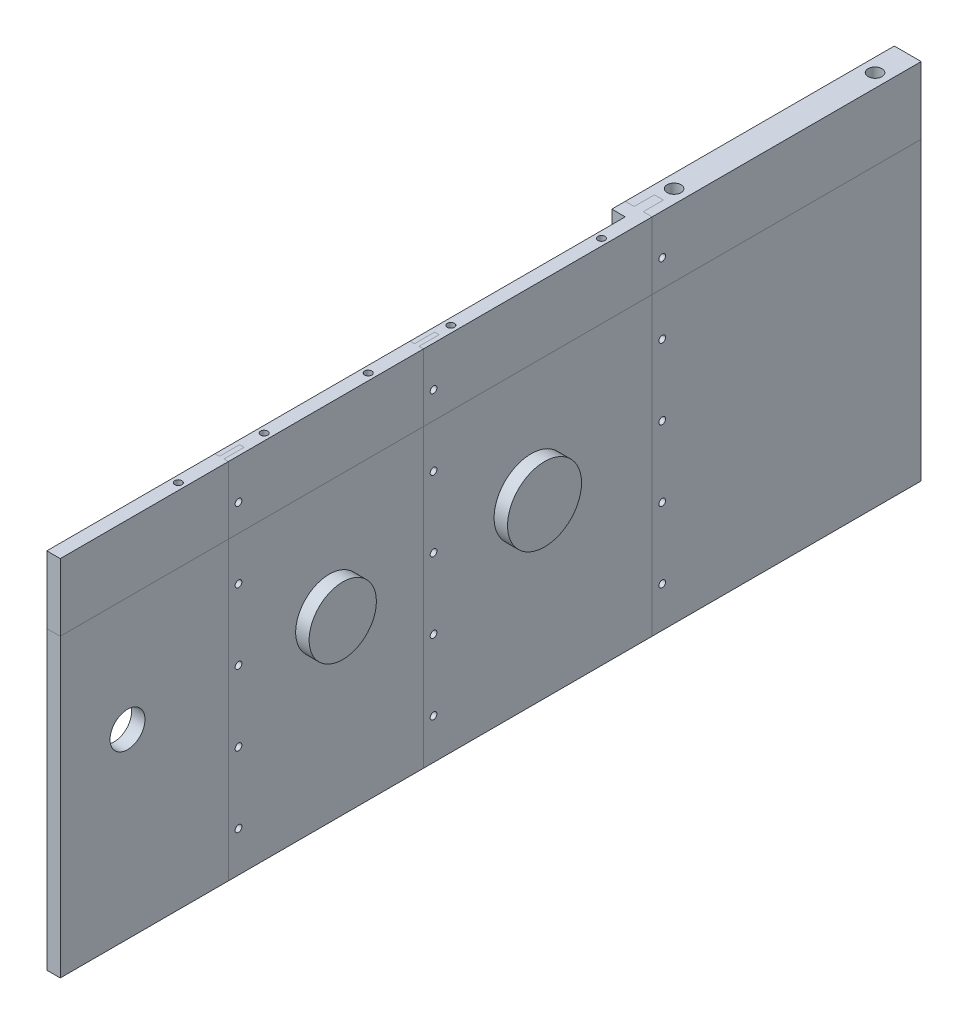
from build123d import *

# Parameters (mm, degrees)
SKETCH1_W               = 640
SKETCH1_H               = 270
SKETCH1_R               = 13
SKETCH1_R_2             = 14
SKETCH1_R_3             = 20.15
BOSS_EXTRUDE1_DEPTH     = 10
SKETCH2_W               = 200
SKETCH2_H               = 270
SKETCH2_R               = 7.94
BOSS_EXTRUDE2_DEPTH     = 20
SKETCH3_W               = 190
SKETCH3_H               = 270
CUT_EXTRUDE1_DEPTH      = 10
SKETCH4_W               = 10
SKETCH4_H               = 270
BOSS_EXTRUDE3_DEPTH     = 10
SKETCH5_W               = 10
SKETCH5_H               = 270
CUT_EXTRUDE2_DEPTH      = 10
CUT_EXTRUDE3_DEPTH      = 348.455033062
CUT_EXTRUDE3_DEPTH_BACK = 348.455033062
SKETCH8_R               = 20.15
SKETCH12_W              = 200
SKETCH12_H              = 270
BOSS_EXTRUDE4_DEPTH     = 10
CUT_EXTRUDE4_DEPTH      = 348.886475736
CUT_EXTRUDE4_DEPTH_BACK = 348.886475736
SKETCH14_R              = 2.5
SPLIT1_OUTLINE_W        = 270
SPLIT1_OUTLINE_H        = 155
SPLIT1_OUTLINE_R        = 14
SPLIT1_DEPTH            = 10
SPLIT1_START            = -3.34
SPLIT1_2_OUTLINE_W      = 270
SPLIT1_2_OUTLINE_H      = 25
SPLIT1_2_OUTLINE_R      = 2.5
SPLIT1_2_DEPTH          = 6.68
SPLIT1_START_2          = -10
SPLIT1_3_OUTLINE_W      = 270
SPLIT1_3_OUTLINE_H      = 10
SPLIT1_3_DEPTH          = 6.66
SPLIT1_4_OUTLINE_W      = 270
SPLIT1_4_OUTLINE_H      = 15
SPLIT1_4_OUTLINE_R      = 2.5
SPLIT1_4_DEPTH          = 3.33
SPLIT1_START_3          = 6.67
SPLIT1_5_OUTLINE_W      = 270
SPLIT1_5_OUTLINE_H      = 15
SPLIT1_5_OUTLINE_R      = 2.5
SPLIT1_5_DEPTH          = 3.33
SPLIT1_6_OUTLINE_W      = 270
SPLIT1_6_OUTLINE_H      = 130
SPLIT1_6_OUTLINE_R      = 13
SPLIT1_6_DEPTH          = 10
SPLIT1_START_4          = 3.33
SPLIT1_7_OUTLINE_W      = 270
SPLIT1_7_OUTLINE_H      = 15
SPLIT1_7_OUTLINE_R      = 2.5
SPLIT1_7_DEPTH          = 3.34
SPLIT1_8_OUTLINE_W      = 270
SPLIT1_8_OUTLINE_H      = 15
SPLIT1_8_OUTLINE_R      = 2.5
SPLIT1_8_DEPTH          = 3.33
SPLIT1_9_OUTLINE_W      = 270
SPLIT1_9_OUTLINE_H      = 15
SPLIT1_9_OUTLINE_R      = 2.5
SPLIT1_9_DEPTH          = 3.33
SPLIT1_10_OUTLINE_W     = 270
SPLIT1_10_OUTLINE_H     = 125
SPLIT1_10_OUTLINE_R     = 13
SPLIT1_10_DEPTH         = 10
SPLIT1_11_OUTLINE_W     = 270
SPLIT1_11_OUTLINE_H     = 15
SPLIT1_11_OUTLINE_R     = 2.5
SPLIT1_11_DEPTH         = 3.34
SPLIT1_START_5          = -11
SPLIT1_12_OUTLINE_W     = 270
SPLIT1_12_OUTLINE_H     = 440
SPLIT1_12_OUTLINE_R     = 13
SPLIT1_12_OUTLINE_R_2   = 2.5
SPLIT1_12_OUTLINE_R_3   = 14
SPLIT1_12_DEPTH         = 21
SPLIT1_13_OUTLINE_W     = 270
SPLIT1_13_OUTLINE_H     = 15
SPLIT1_13_OUTLINE_R     = 2.5
SPLIT1_13_DEPTH         = 6.68
SKETCH15_R              = 5.15
SKETCH15_R_2            = 2.65
CUT_EXTRUDE5_DEPTH      = 100
SPLIT2_OUTLINE_W        = 50
SPLIT2_OUTLINE_H        = 185
SPLIT2_OUTLINE_R        = 2.5
SPLIT2_DEPTH            = 2.3499999
SPLIT2_START            = 7.6500001
SPLIT2_2_OUTLINE_W      = 50
SPLIT2_2_OUTLINE_H      = 170
SPLIT2_2_OUTLINE_R      = 2.5
SPLIT2_2_DEPTH          = 2.3499999
SPLIT2_START_2          = -10
SPLIT2_3_OUTLINE_W      = 50
SPLIT2_3_OUTLINE_H      = 10
SPLIT2_3_DEPTH          = 20
SPLIT2_START_3          = -3.34
SPLIT2_4_OUTLINE_W      = 50
SPLIT2_4_OUTLINE_H      = 15
SPLIT2_4_OUTLINE_R      = 2.5
SPLIT2_4_DEPTH          = 6.68
SPLIT2_5_OUTLINE_W      = 50
SPLIT2_5_OUTLINE_H      = 15
SPLIT2_5_OUTLINE_R      = 2.5
SPLIT2_5_DEPTH          = 3.33
SPLIT2_START_4          = 6.67
SPLIT2_6_OUTLINE_W      = 50
SPLIT2_6_OUTLINE_H      = 15
SPLIT2_6_OUTLINE_R      = 2.5
SPLIT2_6_DEPTH          = 3.33
SPLIT2_START_5          = 85
SPLIT2_7_DEPTH          = 50
SPLIT2_8_OUTLINE_W      = 50
SPLIT2_8_OUTLINE_H      = 125
SPLIT2_8_DEPTH          = 2.3499999
SPLIT2_9_OUTLINE_W      = 50
SPLIT2_9_OUTLINE_H      = 125
SPLIT2_9_DEPTH          = 2.3499999
SPLIT2_START_6          = 3.33
SPLIT2_10_OUTLINE_W     = 50
SPLIT2_10_OUTLINE_H     = 15
SPLIT2_10_OUTLINE_R     = 2.5
SPLIT2_10_DEPTH         = 3.34
SPLIT2_11_DEPTH         = 50
SPLIT2_12_OUTLINE_R     = 2.65
SPLIT2_12_DEPTH         = 50
SPLIT2_13_OUTLINE_R     = 2.65
SPLIT2_13_DEPTH         = 50
SPLIT2_14_OUTLINE_R     = 5.15
SPLIT2_14_DEPTH         = 50
SPLIT2_15_OUTLINE_W     = 50
SPLIT2_15_OUTLINE_H     = 145
SPLIT2_15_OUTLINE_R     = 2.5
SPLIT2_15_DEPTH         = 2.3499999
SPLIT2_16_OUTLINE_W     = 50
SPLIT2_16_OUTLINE_H     = 145
SPLIT2_16_OUTLINE_R     = 2.5
SPLIT2_16_DEPTH         = 2.3499999
SPLIT2_17_OUTLINE_W     = 50
SPLIT2_17_OUTLINE_H     = 15
SPLIT2_17_OUTLINE_R     = 2.5
SPLIT2_17_DEPTH         = 3.34
SPLIT2_18_OUTLINE_W     = 50
SPLIT2_18_OUTLINE_H     = 15
SPLIT2_18_OUTLINE_R     = 2.5
SPLIT2_18_DEPTH         = 3.33
SPLIT2_19_OUTLINE_W     = 50
SPLIT2_19_OUTLINE_H     = 15
SPLIT2_19_OUTLINE_R     = 2.5
SPLIT2_19_DEPTH         = 3.33
SPLIT2_20_DEPTH         = 50
SPLIT2_21_OUTLINE_R     = 2.65
SPLIT2_21_DEPTH         = 50
SPLIT2_22_OUTLINE_W     = 50
SPLIT2_22_OUTLINE_H     = 200
SPLIT2_22_OUTLINE_R     = 2.5
SPLIT2_22_DEPTH         = 4.8499999
SPLIT2_START_7          = 5.1500001
SPLIT2_23_OUTLINE_W     = 50
SPLIT2_23_OUTLINE_H     = 200
SPLIT2_23_OUTLINE_R     = 2.5
SPLIT2_23_DEPTH         = 4.8499999
SPLIT2_24_OUTLINE_W     = 50
SPLIT2_24_OUTLINE_H     = 15
SPLIT2_24_OUTLINE_R     = 2.5
SPLIT2_24_DEPTH         = 6.66
SPLIT2_START_8          = 3.34
SPLIT2_25_OUTLINE_W     = 50
SPLIT2_25_OUTLINE_H     = 15
SPLIT2_25_OUTLINE_R     = 2.5
SPLIT2_25_DEPTH         = 6.66
SPLIT2_26_DEPTH         = 50
SKETCH17_R              = 25
BOSS_EXTRUDE5_DEPTH     = 10
SKETCH18_R              = 27.5
BOSS_EXTRUDE6_DEPTH     = 10


with BuildPart() as part:
    # Sketch1 → Boss-Extrude1 (new body)
    with BuildSketch(Plane(origin=(0, 0, 0), x_dir=(0, 0, -1), z_dir=(1, 0, 0))):
        Rectangle(SKETCH1_W, SKETCH1_H)
        with Locations((-270, 0)):
            Circle(SKETCH1_R, mode=Mode.SUBTRACT)
        with Locations((-120, 0)):
            Circle(SKETCH1_R, mode=Mode.SUBTRACT)
        with Locations((30, 0)):
            Circle(SKETCH1_R_2, mode=Mode.SUBTRACT)
        with Locations((180, 0)):
            Circle(SKETCH1_R_3, mode=Mode.SUBTRACT)
    extrude(amount=BOSS_EXTRUDE1_DEPTH)

    # Sketch2 → Boss-Extrude2 (add)
    with BuildSketch(Plane(origin=(10, 0, 0), x_dir=(0, 0, -1), z_dir=(1, 0, 0))):
        with Locations((220, 0)):
            Rectangle(SKETCH2_W, SKETCH2_H)
        with Locations((180, 0)):
            Circle(SKETCH2_R, mode=Mode.SUBTRACT)
    extrude(amount=-BOSS_EXTRUDE2_DEPTH)

    # Sketch3 → Cut-Extrude1 (cut)
    with BuildSketch(Plane(origin=(10, 0, 0), x_dir=(0, 0, -1), z_dir=(1, 0, 0))):
        with Locations((225, 0)):
            Rectangle(SKETCH3_W, SKETCH3_H)
    extrude(amount=-CUT_EXTRUDE1_DEPTH, mode=Mode.SUBTRACT)

    # Sketch4 → Boss-Extrude3 (add)
    with BuildSketch(Plane.ZY):
        with Locations((-115, 0)):
            Rectangle(SKETCH4_W, SKETCH4_H)
    extrude(amount=BOSS_EXTRUDE3_DEPTH)

    # Sketch5 → Cut-Extrude2 (cut)
    with BuildSketch(Plane(origin=(10, 0, 0), x_dir=(0, 0, -1), z_dir=(1, 0, 0))):
        with Locations((125, 0)):
            Rectangle(SKETCH5_W, SKETCH5_H)
    extrude(amount=-CUT_EXTRUDE2_DEPTH, mode=Mode.SUBTRACT)

    # Sketch8 → Cut-Extrude3 (cut, two sides: drawn at the far end of the back side and taken through both)
    with BuildSketch(Plane(origin=(0, 0, 0), x_dir=(0, 0, -1), z_dir=(1, 0, 0)).offset(-CUT_EXTRUDE3_DEPTH_BACK)):
        with Locations((180, 0)):
            Circle(SKETCH8_R)
    extrude(amount=CUT_EXTRUDE3_DEPTH + CUT_EXTRUDE3_DEPTH_BACK, mode=Mode.SUBTRACT)

    # Sketch12 → Boss-Extrude4 (add)
    with BuildSketch(Plane(origin=(0, 0, 0), x_dir=(0, 0, -1), z_dir=(1, 0, 0))):
        with Locations((220, 0)):
            Rectangle(SKETCH12_W, SKETCH12_H)
    extrude(amount=BOSS_EXTRUDE4_DEPTH)

    # Sketch14 → Cut-Extrude4 (cut, two sides: drawn at the far end of the back side and taken through both)
    with BuildSketch(Plane(origin=(10, 0, 0), x_dir=(0, 0, -1), z_dir=(1, 0, 0)).offset(-CUT_EXTRUDE4_DEPTH_BACK)):
        with Locations((-42.5, 105)):
            Circle(SKETCH14_R)
        with Locations((-42.5, 52.5)):
            Circle(SKETCH14_R)
        with Locations((-42.5, 0)):
            Circle(SKETCH14_R)
        with Locations((-42.5, -52.5)):
            Circle(SKETCH14_R)
        with Locations((-42.5, -105)):
            Circle(SKETCH14_R)
        with Locations(Location((127.5, -105, 0), (0, 0, 180))):
            Circle(SKETCH14_R)
        with Locations(Location((127.5, -52.5, 0), (0, 0, 180))):
            Circle(SKETCH14_R)
        with Locations(Location((127.5, 0, 0), (0, 0, 180))):
            Circle(SKETCH14_R)
        with Locations(Location((127.5, 52.5, 0), (0, 0, 180))):
            Circle(SKETCH14_R)
        with Locations(Location((127.5, 105, 0), (0, 0, 180))):
            Circle(SKETCH14_R)
        with Locations((-187.5, -105)):
            Circle(SKETCH14_R)
        with Locations((-187.5, -52.5)):
            Circle(SKETCH14_R)
        with Locations((-187.5, 0)):
            Circle(SKETCH14_R)
        with Locations((-187.5, 52.5)):
            Circle(SKETCH14_R)
        with Locations((-187.5, 105)):
            Circle(SKETCH14_R)
    extrude(amount=CUT_EXTRUDE4_DEPTH + CUT_EXTRUDE4_DEPTH_BACK, mode=Mode.SUBTRACT)

    # Split1 12 outline → Split1 12 (cut)
    with BuildSketch(Plane.YZ.offset(SPLIT1_START_5)):
        with Locations((0, 100)):
            Rectangle(SPLIT1_12_OUTLINE_W, SPLIT1_12_OUTLINE_H)
        with Locations((0, 270)):
            Circle(SPLIT1_12_OUTLINE_R, mode=Mode.SUBTRACT)
        with Locations((-105, 42.5)):
            Circle(SPLIT1_12_OUTLINE_R_2, mode=Mode.SUBTRACT)
        with Locations((-52.5, 42.5)):
            Circle(SPLIT1_12_OUTLINE_R_2, mode=Mode.SUBTRACT)
        with Locations((0, -30)):
            Circle(SPLIT1_12_OUTLINE_R_3, mode=Mode.SUBTRACT)
        with Locations((0, 42.5)):
            Circle(SPLIT1_12_OUTLINE_R_2, mode=Mode.SUBTRACT)
        with Locations((52.5, 42.5)):
            Circle(SPLIT1_12_OUTLINE_R_2, mode=Mode.SUBTRACT)
        with Locations((105, 42.5)):
            Circle(SPLIT1_12_OUTLINE_R_2, mode=Mode.SUBTRACT)
        with Locations((-105, 187.5)):
            Circle(SPLIT1_12_OUTLINE_R_2, mode=Mode.SUBTRACT)
        with Locations((-52.5, 187.5)):
            Circle(SPLIT1_12_OUTLINE_R_2, mode=Mode.SUBTRACT)
        with Locations((0, 120)):
            Circle(SPLIT1_12_OUTLINE_R, mode=Mode.SUBTRACT)
        with Locations((0, 187.5)):
            Circle(SPLIT1_12_OUTLINE_R_2, mode=Mode.SUBTRACT)
        with Locations((52.5, 187.5)):
            Circle(SPLIT1_12_OUTLINE_R_2, mode=Mode.SUBTRACT)
        with Locations((105, 187.5)):
            Circle(SPLIT1_12_OUTLINE_R_2, mode=Mode.SUBTRACT)
    extrude(amount=SPLIT1_12_DEPTH, mode=Mode.SUBTRACT)

    # Split1 13 outline → Split1 13 (cut)
    with BuildSketch(Plane.YZ.offset(SPLIT1_START)):
        with Locations((0, -127.5)):
            Rectangle(SPLIT1_13_OUTLINE_W, SPLIT1_13_OUTLINE_H)
        with Locations((-105, -127.5)):
            Circle(SPLIT1_13_OUTLINE_R, mode=Mode.SUBTRACT)
        with Locations((-52.5, -127.5)):
            Circle(SPLIT1_13_OUTLINE_R, mode=Mode.SUBTRACT)
        with Locations((0, -127.5)):
            Circle(SPLIT1_13_OUTLINE_R, mode=Mode.SUBTRACT)
        with Locations((52.5, -127.5)):
            Circle(SPLIT1_13_OUTLINE_R, mode=Mode.SUBTRACT)
        with Locations((105, -127.5)):
            Circle(SPLIT1_13_OUTLINE_R, mode=Mode.SUBTRACT)
    extrude(amount=SPLIT1_13_DEPTH, mode=Mode.SUBTRACT)


with BuildPart() as body_2:
    # Split1: read off the stored shape, not the designer's step
    # Split1 outline → Split1 (new body)
    with BuildSketch(Plane.YZ):
        with Locations((0, -42.5)):
            Rectangle(SPLIT1_OUTLINE_W, SPLIT1_OUTLINE_H)
        with Locations((0, -30)):
            Circle(SPLIT1_OUTLINE_R, mode=Mode.SUBTRACT)
    extrude(amount=SPLIT1_DEPTH)

    # Split1 2 outline → Split1 2 (add)
    with BuildSketch(Plane.YZ.offset(SPLIT1_START)):
        with Locations((0, -122.5)):
            Rectangle(SPLIT1_2_OUTLINE_W, SPLIT1_2_OUTLINE_H)
        with Locations((-105, -127.5)):
            Circle(SPLIT1_2_OUTLINE_R, mode=Mode.SUBTRACT)
        with Locations((-52.5, -127.5)):
            Circle(SPLIT1_2_OUTLINE_R, mode=Mode.SUBTRACT)
        with Locations((0, -127.5)):
            Circle(SPLIT1_2_OUTLINE_R, mode=Mode.SUBTRACT)
        with Locations((52.5, -127.5)):
            Circle(SPLIT1_2_OUTLINE_R, mode=Mode.SUBTRACT)
        with Locations((105, -127.5)):
            Circle(SPLIT1_2_OUTLINE_R, mode=Mode.SUBTRACT)
    extrude(amount=SPLIT1_2_DEPTH)

    # Split1 3 outline → Split1 3 (add)
    with BuildSketch(Plane.YZ.offset(SPLIT1_START_2)):
        with Locations((0, -115)):
            Rectangle(SPLIT1_3_OUTLINE_W, SPLIT1_3_OUTLINE_H)
    extrude(amount=SPLIT1_3_DEPTH)

    # Split1 4 outline → Split1 4 (add)
    with BuildSketch(Plane.YZ):
        with Locations((0, 42.5)):
            Rectangle(SPLIT1_4_OUTLINE_W, SPLIT1_4_OUTLINE_H)
        with Locations((-105, 42.5)):
            Circle(SPLIT1_4_OUTLINE_R, mode=Mode.SUBTRACT)
        with Locations((-52.5, 42.5)):
            Circle(SPLIT1_4_OUTLINE_R, mode=Mode.SUBTRACT)
        with Locations((0, 42.5)):
            Circle(SPLIT1_4_OUTLINE_R, mode=Mode.SUBTRACT)
        with Locations((52.5, 42.5)):
            Circle(SPLIT1_4_OUTLINE_R, mode=Mode.SUBTRACT)
        with Locations((105, 42.5)):
            Circle(SPLIT1_4_OUTLINE_R, mode=Mode.SUBTRACT)
    extrude(amount=SPLIT1_4_DEPTH)

    # Split1 5 outline → Split1 5 (add)
    with BuildSketch(Plane.YZ.offset(SPLIT1_START_3)):
        with Locations((0, 42.5)):
            Rectangle(SPLIT1_5_OUTLINE_W, SPLIT1_5_OUTLINE_H)
        with Locations((-105, 42.5)):
            Circle(SPLIT1_5_OUTLINE_R, mode=Mode.SUBTRACT)
        with Locations((-52.5, 42.5)):
            Circle(SPLIT1_5_OUTLINE_R, mode=Mode.SUBTRACT)
        with Locations((0, 42.5)):
            Circle(SPLIT1_5_OUTLINE_R, mode=Mode.SUBTRACT)
        with Locations((52.5, 42.5)):
            Circle(SPLIT1_5_OUTLINE_R, mode=Mode.SUBTRACT)
        with Locations((105, 42.5)):
            Circle(SPLIT1_5_OUTLINE_R, mode=Mode.SUBTRACT)
    extrude(amount=SPLIT1_5_DEPTH)


with BuildPart() as body_3:
    # Split1 6 outline → Split1 6 (new body)
    with BuildSketch(Plane.YZ):
        with Locations((0, 115)):
            Rectangle(SPLIT1_6_OUTLINE_W, SPLIT1_6_OUTLINE_H)
        with Locations((0, 120)):
            Circle(SPLIT1_6_OUTLINE_R, mode=Mode.SUBTRACT)
    extrude(amount=SPLIT1_6_DEPTH)

    # Split1 7 outline → Split1 7 (add)
    with BuildSketch(Plane.YZ.offset(SPLIT1_START_4)):
        with Locations((0, 42.5)):
            Rectangle(SPLIT1_7_OUTLINE_W, SPLIT1_7_OUTLINE_H)
        with Locations((-105, 42.5)):
            Circle(SPLIT1_7_OUTLINE_R, mode=Mode.SUBTRACT)
        with Locations((-52.5, 42.5)):
            Circle(SPLIT1_7_OUTLINE_R, mode=Mode.SUBTRACT)
        with Locations((0, 42.5)):
            Circle(SPLIT1_7_OUTLINE_R, mode=Mode.SUBTRACT)
        with Locations((52.5, 42.5)):
            Circle(SPLIT1_7_OUTLINE_R, mode=Mode.SUBTRACT)
        with Locations((105, 42.5)):
            Circle(SPLIT1_7_OUTLINE_R, mode=Mode.SUBTRACT)
    extrude(amount=SPLIT1_7_DEPTH)

    # Split1 8 outline → Split1 8 (add)
    with BuildSketch(Plane.YZ):
        with Locations((0, 187.5)):
            Rectangle(SPLIT1_8_OUTLINE_W, SPLIT1_8_OUTLINE_H)
        with Locations((-105, 187.5)):
            Circle(SPLIT1_8_OUTLINE_R, mode=Mode.SUBTRACT)
        with Locations((-52.5, 187.5)):
            Circle(SPLIT1_8_OUTLINE_R, mode=Mode.SUBTRACT)
        with Locations((0, 187.5)):
            Circle(SPLIT1_8_OUTLINE_R, mode=Mode.SUBTRACT)
        with Locations((52.5, 187.5)):
            Circle(SPLIT1_8_OUTLINE_R, mode=Mode.SUBTRACT)
        with Locations((105, 187.5)):
            Circle(SPLIT1_8_OUTLINE_R, mode=Mode.SUBTRACT)
    extrude(amount=SPLIT1_8_DEPTH)

    # Split1 9 outline → Split1 9 (add)
    with BuildSketch(Plane.YZ.offset(SPLIT1_START_3)):
        with Locations((0, 187.5)):
            Rectangle(SPLIT1_9_OUTLINE_W, SPLIT1_9_OUTLINE_H)
        with Locations((-105, 187.5)):
            Circle(SPLIT1_9_OUTLINE_R, mode=Mode.SUBTRACT)
        with Locations((-52.5, 187.5)):
            Circle(SPLIT1_9_OUTLINE_R, mode=Mode.SUBTRACT)
        with Locations((0, 187.5)):
            Circle(SPLIT1_9_OUTLINE_R, mode=Mode.SUBTRACT)
        with Locations((52.5, 187.5)):
            Circle(SPLIT1_9_OUTLINE_R, mode=Mode.SUBTRACT)
        with Locations((105, 187.5)):
            Circle(SPLIT1_9_OUTLINE_R, mode=Mode.SUBTRACT)
    extrude(amount=SPLIT1_9_DEPTH)


with BuildPart() as body_4:
    # Split1 10 outline → Split1 10 (new body)
    with BuildSketch(Plane.YZ):
        with Locations((0, 257.5)):
            Rectangle(SPLIT1_10_OUTLINE_W, SPLIT1_10_OUTLINE_H)
        with Locations((0, 270)):
            Circle(SPLIT1_10_OUTLINE_R, mode=Mode.SUBTRACT)
    extrude(amount=SPLIT1_10_DEPTH)

    # Split1 11 outline → Split1 11 (add)
    with BuildSketch(Plane.YZ.offset(SPLIT1_START_4)):
        with Locations((0, 187.5)):
            Rectangle(SPLIT1_11_OUTLINE_W, SPLIT1_11_OUTLINE_H)
        with Locations((-105, 187.5)):
            Circle(SPLIT1_11_OUTLINE_R, mode=Mode.SUBTRACT)
        with Locations((-52.5, 187.5)):
            Circle(SPLIT1_11_OUTLINE_R, mode=Mode.SUBTRACT)
        with Locations((0, 187.5)):
            Circle(SPLIT1_11_OUTLINE_R, mode=Mode.SUBTRACT)
        with Locations((52.5, 187.5)):
            Circle(SPLIT1_11_OUTLINE_R, mode=Mode.SUBTRACT)
        with Locations((105, 187.5)):
            Circle(SPLIT1_11_OUTLINE_R, mode=Mode.SUBTRACT)
    extrude(amount=SPLIT1_11_DEPTH)


with BuildPart() as cut_extrude5_tool:
    # Sketch15 → Cut-Extrude5 (new body)
    with BuildSketch(Plane(origin=(0, 135, 0), x_dir=(1, 0, 0), z_dir=(0, 1, 0))):
        with Locations(Location((0, 295.673954542, 0), (0, 0, 270))):
            Circle(SKETCH15_R)
        with Locations(Location((0, 146.286931387, 0), (0, 0, 270))):
            Circle(SKETCH15_R)
        with Locations(Location((5, 87.264370098, 0), (0, 0, 270))):
            Circle(SKETCH15_R_2)
        with Locations(Location((5, -24.653825531, 0), (0, 0, 270))):
            Circle(SKETCH15_R_2)
        with Locations(Location((5, -86.063192997, 0), (0, 0, 270))):
            Circle(SKETCH15_R_2)
        with Locations(Location((5, -163.412693245, 0), (0, 0, 270))):
            Circle(SKETCH15_R_2)
        with Locations(Location((5, -227.217653234, 0), (0, 0, 270))):
            Circle(SKETCH15_R_2)
    extrude(amount=-CUT_EXTRUDE5_DEPTH)


with BuildPart() as part_1:
    add(part.part)

    # Cut-Extrude5: cut by cut_extrude5_tool
    add(cut_extrude5_tool.part, mode=Mode.SUBTRACT)

    # Split2 14 outline → Split2 14 (cut)
    with BuildSketch(Plane(origin=(0, 0, 0), x_dir=(1, 0, 0), z_dir=(0, 1, 0)).offset(SPLIT2_START_5)):
        Polygon((-3.34, 135), (3.34, 135), (3.34, 120), (10, 120), (10, 320), (-10, 320), (-10, 120), (-3.34, 120), align=None)
        with Locations((0, 146.286931387)):
            Circle(SPLIT2_14_OUTLINE_R, mode=Mode.SUBTRACT)
        with Locations((0, 295.673954542)):
            Circle(SPLIT2_14_OUTLINE_R, mode=Mode.SUBTRACT)
    extrude(amount=SPLIT2_14_DEPTH, mode=Mode.SUBTRACT)


with BuildPart() as body_2_1:
    add(body_2.part)

    # Cut-Extrude5: cut by cut_extrude5_tool
    add(cut_extrude5_tool.part, mode=Mode.SUBTRACT)

    # Split2 21 outline → Split2 21 (cut)
    with BuildSketch(Plane(origin=(0, 0, 0), x_dir=(1, 0, 0), z_dir=(0, 1, 0)).offset(SPLIT2_START_5)):
        Polygon((3.34, 120), (3.34, 135), (-3.34, 135), (-3.34, 120), (-10, 120), (-10, 110), (0, 110), (0, -50), (3.33, -50), (3.33, -35), (6.67, -35), (6.67, -50), (10, -50), (10, 120), align=None)
        with Locations((5, -24.653825531)):
            Circle(SPLIT2_21_OUTLINE_R, mode=Mode.SUBTRACT)
        with Locations((5, 87.264370098)):
            Circle(SPLIT2_21_OUTLINE_R, mode=Mode.SUBTRACT)
    extrude(amount=SPLIT2_21_DEPTH, mode=Mode.SUBTRACT)

    # Sketch18 → Boss-Extrude6 (add)
    with BuildSketch(Plane(origin=(10, 0, 0), x_dir=(0, 0, -1), z_dir=(1, 0, 0))):
        with Locations((30, 0)):
            Circle(SKETCH18_R)
    extrude(amount=BOSS_EXTRUDE6_DEPTH)


with BuildPart() as body_3_1:
    add(body_3.part)

    # Cut-Extrude5: cut by cut_extrude5_tool
    add(cut_extrude5_tool.part, mode=Mode.SUBTRACT)

    # Split2 13 outline → Split2 13 (cut)
    with BuildSketch(Plane(origin=(0, 0, 0), x_dir=(1, 0, 0), z_dir=(0, 1, 0)).offset(SPLIT2_START_5)):
        Polygon((3.33, -35), (3.33, -50), (0, -50), (0, -195), (3.33, -195), (3.33, -180), (6.67, -180), (6.67, -195), (10, -195), (10, -50), (6.67, -50), (6.67, -35), align=None)
        with Locations((5, -163.412693245)):
            Circle(SPLIT2_13_OUTLINE_R, mode=Mode.SUBTRACT)
        with Locations((5, -86.063192997)):
            Circle(SPLIT2_13_OUTLINE_R, mode=Mode.SUBTRACT)
    extrude(amount=SPLIT2_13_DEPTH, mode=Mode.SUBTRACT)

    # Sketch17 → Boss-Extrude5 (add)
    with BuildSketch(Plane(origin=(10, 0, 0), x_dir=(0, 0, -1), z_dir=(1, 0, 0))):
        with Locations((-120, 0)):
            Circle(SKETCH17_R)
    extrude(amount=BOSS_EXTRUDE5_DEPTH)


with BuildPart() as body_4_1:
    add(body_4.part)

    # Cut-Extrude5: cut by cut_extrude5_tool
    add(cut_extrude5_tool.part, mode=Mode.SUBTRACT)

    # Split2 12 outline → Split2 12 (cut)
    with BuildSketch(Plane(origin=(0, 0, 0), x_dir=(1, 0, 0), z_dir=(0, 1, 0)).offset(SPLIT2_START_5)):
        Polygon((10, -195), (6.67, -195), (6.67, -180), (3.33, -180), (3.33, -195), (0, -195), (0, -320), (10, -320), align=None)
        with Locations((5, -227.217653234)):
            Circle(SPLIT2_12_OUTLINE_R, mode=Mode.SUBTRACT)
    extrude(amount=SPLIT2_12_DEPTH, mode=Mode.SUBTRACT)


with BuildPart() as body_5:
    # Split2: read off the stored shape, not the designer's step
    # Split2 outline → Split2 (new body)
    with BuildSketch(Plane.YZ):
        with Locations((110, -42.5)):
            Rectangle(SPLIT2_OUTLINE_W, SPLIT2_OUTLINE_H)
        with Locations((105, 42.5)):
            Circle(SPLIT2_OUTLINE_R, mode=Mode.SUBTRACT)
        with Locations((105, -127.5)):
            Circle(SPLIT2_OUTLINE_R, mode=Mode.SUBTRACT)
    extrude(amount=SPLIT2_DEPTH)

    # Split2 2 outline → Split2 2 (add)
    with BuildSketch(Plane.YZ.offset(SPLIT2_START)):
        with Locations((110, -35)):
            Rectangle(SPLIT2_2_OUTLINE_W, SPLIT2_2_OUTLINE_H)
        with Locations((105, 42.5)):
            Circle(SPLIT2_2_OUTLINE_R, mode=Mode.SUBTRACT)
    extrude(amount=SPLIT2_2_DEPTH)

    # Split2 3 outline → Split2 3 (add)
    with BuildSketch(Plane.YZ.offset(SPLIT2_START_2)):
        with Locations((110, -115)):
            Rectangle(SPLIT2_3_OUTLINE_W, SPLIT2_3_OUTLINE_H)
    extrude(amount=SPLIT2_3_DEPTH)

    # Split2 4 outline → Split2 4 (add)
    with BuildSketch(Plane.YZ.offset(SPLIT2_START_3)):
        with Locations((110, -127.5)):
            Rectangle(SPLIT2_4_OUTLINE_W, SPLIT2_4_OUTLINE_H)
        with Locations((105, -127.5)):
            Circle(SPLIT2_4_OUTLINE_R, mode=Mode.SUBTRACT)
    extrude(amount=SPLIT2_4_DEPTH)

    # Split2 5 outline → Split2 5 (add)
    with BuildSketch(Plane.YZ):
        with Locations((110, 42.5)):
            Rectangle(SPLIT2_5_OUTLINE_W, SPLIT2_5_OUTLINE_H)
        with Locations((105, 42.5)):
            Circle(SPLIT2_5_OUTLINE_R, mode=Mode.SUBTRACT)
    extrude(amount=SPLIT2_5_DEPTH)

    # Split2 6 outline → Split2 6 (add)
    with BuildSketch(Plane.YZ.offset(SPLIT2_START_4)):
        with Locations((110, 42.5)):
            Rectangle(SPLIT2_6_OUTLINE_W, SPLIT2_6_OUTLINE_H)
        with Locations((105, 42.5)):
            Circle(SPLIT2_6_OUTLINE_R, mode=Mode.SUBTRACT)
    extrude(amount=SPLIT2_6_DEPTH)

    # Split2 7 outline → Split2 7 (add)
    with BuildSketch(Plane(origin=(0, 0, 0), x_dir=(1, 0, 0), z_dir=(0, 1, 0)).offset(SPLIT2_START_5)):
        with BuildLine():
            Line((7.6500001, -35), (7.65, -24.653825531))
            ThreePointArc((7.65, -24.653825531), (5, -27.303825531), (2.35, -24.653825531))
            Line((2.35, -24.653825531), (2.3499999, -35))
            Line((2.3499999, -35), (7.6500001, -35))
        make_face()
        with BuildLine():
            ThreePointArc((2.35, -24.653825531), (5, -22.003825531), (7.65, -24.653825531))
            Line((7.65, -24.653825531), (7.65, 87.264370098))
            ThreePointArc((7.65, 87.264370098), (5, 84.614370098), (2.35, 87.264370098))
            Line((2.35, 87.264370098), (2.35, -24.653825531))
        make_face()
        with BuildLine():
            ThreePointArc((2.35, 87.264370098), (5, 89.914370098), (7.65, 87.264370098))
            Line((7.65, 87.264370098), (7.6500001, 110))
            Line((7.6500001, 110), (2.3499999, 110))
            Line((2.3499999, 110), (2.35, 87.264370098))
        make_face()
    extrude(amount=SPLIT2_7_DEPTH)


with BuildPart() as body_6:
    # Split2 8 outline → Split2 8 (new body)
    with BuildSketch(Plane.YZ):
        with Locations((110, 257.5)):
            Rectangle(SPLIT2_8_OUTLINE_W, SPLIT2_8_OUTLINE_H)
    extrude(amount=SPLIT2_8_DEPTH)

    # Split2 9 outline → Split2 9 (add)
    with BuildSketch(Plane.YZ.offset(SPLIT2_START)):
        with Locations((110, 257.5)):
            Rectangle(SPLIT2_9_OUTLINE_W, SPLIT2_9_OUTLINE_H)
    extrude(amount=SPLIT2_9_DEPTH)

    # Split2 10 outline → Split2 10 (add)
    with BuildSketch(Plane.YZ.offset(SPLIT2_START_6)):
        with Locations((110, 187.5)):
            Rectangle(SPLIT2_10_OUTLINE_W, SPLIT2_10_OUTLINE_H)
        with Locations((105, 187.5)):
            Circle(SPLIT2_10_OUTLINE_R, mode=Mode.SUBTRACT)
    extrude(amount=SPLIT2_10_DEPTH)

    # Split2 11 outline → Split2 11 (add)
    with BuildSketch(Plane(origin=(0, 0, 0), x_dir=(1, 0, 0), z_dir=(0, 1, 0)).offset(SPLIT2_START_5)):
        with BuildLine():
            Line((7.6500001, -195), (2.3499999, -195))
            Line((2.3499999, -195), (2.35, -227.217653234))
            ThreePointArc((2.35, -227.217653234), (5, -224.567653234), (7.65, -227.217653234))
            Line((7.65, -227.217653234), (7.6500001, -195))
        make_face()
        with BuildLine():
            ThreePointArc((7.65, -227.217653234), (5, -229.867653234), (2.35, -227.217653234))
            Line((2.35, -227.217653234), (2.3499999, -320))
            Line((2.3499999, -320), (7.6500001, -320))
            Line((7.6500001, -320), (7.65, -227.217653234))
        make_face()
    extrude(amount=SPLIT2_11_DEPTH)


with BuildPart() as body_7:
    # Split2 15 outline → Split2 15 (new body)
    with BuildSketch(Plane.YZ):
        with Locations((110, 122.5)):
            Rectangle(SPLIT2_15_OUTLINE_W, SPLIT2_15_OUTLINE_H)
        with Locations((105, 187.5)):
            Circle(SPLIT2_15_OUTLINE_R, mode=Mode.SUBTRACT)
    extrude(amount=SPLIT2_15_DEPTH)

    # Split2 16 outline → Split2 16 (add)
    with BuildSketch(Plane.YZ.offset(SPLIT2_START)):
        with Locations((110, 122.5)):
            Rectangle(SPLIT2_16_OUTLINE_W, SPLIT2_16_OUTLINE_H)
        with Locations((105, 187.5)):
            Circle(SPLIT2_16_OUTLINE_R, mode=Mode.SUBTRACT)
    extrude(amount=SPLIT2_16_DEPTH)

    # Split2 17 outline → Split2 17 (add)
    with BuildSketch(Plane.YZ.offset(SPLIT2_START_6)):
        with Locations((110, 42.5)):
            Rectangle(SPLIT2_17_OUTLINE_W, SPLIT2_17_OUTLINE_H)
        with Locations((105, 42.5)):
            Circle(SPLIT2_17_OUTLINE_R, mode=Mode.SUBTRACT)
    extrude(amount=SPLIT2_17_DEPTH)

    # Split2 18 outline → Split2 18 (add)
    with BuildSketch(Plane.YZ):
        with Locations((110, 187.5)):
            Rectangle(SPLIT2_18_OUTLINE_W, SPLIT2_18_OUTLINE_H)
        with Locations((105, 187.5)):
            Circle(SPLIT2_18_OUTLINE_R, mode=Mode.SUBTRACT)
    extrude(amount=SPLIT2_18_DEPTH)

    # Split2 19 outline → Split2 19 (add)
    with BuildSketch(Plane.YZ.offset(SPLIT2_START_4)):
        with Locations((110, 187.5)):
            Rectangle(SPLIT2_19_OUTLINE_W, SPLIT2_19_OUTLINE_H)
        with Locations((105, 187.5)):
            Circle(SPLIT2_19_OUTLINE_R, mode=Mode.SUBTRACT)
    extrude(amount=SPLIT2_19_DEPTH)

    # Split2 20 outline → Split2 20 (add)
    with BuildSketch(Plane(origin=(0, 0, 0), x_dir=(1, 0, 0), z_dir=(0, 1, 0)).offset(SPLIT2_START_5)):
        with BuildLine():
            Line((7.6500001, -50), (2.3499999, -50))
            Line((2.3499999, -50), (2.35, -86.063192997))
            ThreePointArc((2.35, -86.063192997), (5, -83.413192997), (7.65, -86.063192997))
            Line((7.65, -86.063192997), (7.6500001, -50))
        make_face()
        with BuildLine():
            ThreePointArc((7.65, -86.063192997), (5, -88.713192997), (2.35, -86.063192997))
            Line((2.35, -86.063192997), (2.35, -163.412693245))
            ThreePointArc((2.35, -163.412693245), (5, -160.762693245), (7.65, -163.412693245))
            Line((7.65, -163.412693245), (7.65, -86.063192997))
        make_face()
        with BuildLine():
            ThreePointArc((7.65, -163.412693245), (5, -166.062693245), (2.35, -163.412693245))
            Line((2.35, -163.412693245), (2.3499999, -180))
            Line((2.3499999, -180), (7.6500001, -180))
            Line((7.6500001, -180), (7.65, -163.412693245))
        make_face()
    extrude(amount=SPLIT2_20_DEPTH)


with BuildPart() as body_8:
    # Split2 22 outline → Split2 22 (new body)
    with BuildSketch(Plane.YZ.offset(SPLIT2_START_2)):
        with Locations((110, -220)):
            Rectangle(SPLIT2_22_OUTLINE_W, SPLIT2_22_OUTLINE_H)
        with Locations((105, -127.5)):
            Circle(SPLIT2_22_OUTLINE_R, mode=Mode.SUBTRACT)
    extrude(amount=SPLIT2_22_DEPTH)

    # Split2 23 outline → Split2 23 (add)
    with BuildSketch(Plane.YZ.offset(SPLIT2_START_7)):
        with Locations((110, -220)):
            Rectangle(SPLIT2_23_OUTLINE_W, SPLIT2_23_OUTLINE_H)
        with Locations((105, -127.5)):
            Circle(SPLIT2_23_OUTLINE_R, mode=Mode.SUBTRACT)
    extrude(amount=SPLIT2_23_DEPTH)

    # Split2 24 outline → Split2 24 (add)
    with BuildSketch(Plane.YZ.offset(SPLIT2_START_2)):
        with Locations((110, -127.5)):
            Rectangle(SPLIT2_24_OUTLINE_W, SPLIT2_24_OUTLINE_H)
        with Locations((105, -127.5)):
            Circle(SPLIT2_24_OUTLINE_R, mode=Mode.SUBTRACT)
    extrude(amount=SPLIT2_24_DEPTH)

    # Split2 25 outline → Split2 25 (add)
    with BuildSketch(Plane.YZ.offset(SPLIT2_START_8)):
        with Locations((110, -127.5)):
            Rectangle(SPLIT2_25_OUTLINE_W, SPLIT2_25_OUTLINE_H)
        with Locations((105, -127.5)):
            Circle(SPLIT2_25_OUTLINE_R, mode=Mode.SUBTRACT)
    extrude(amount=SPLIT2_25_DEPTH)

    # Split2 26 outline → Split2 26 (add)
    with BuildSketch(Plane(origin=(0, 0, 0), x_dir=(1, 0, 0), z_dir=(0, 1, 0)).offset(SPLIT2_START_5)):
        with BuildLine():
            Line((-5.1500001, 135), (5.1500001, 135))
            Line((5.1500001, 135), (5.15, 146.286931387))
            ThreePointArc((5.15, 146.286931387), (0, 141.136931387), (-5.15, 146.286931387))
            Line((-5.15, 146.286931387), (-5.1500001, 135))
        make_face()
        with BuildLine():
            Line((-5.15, 295.673954542), (-5.15, 146.286931387))
            ThreePointArc((-5.15, 146.286931387), (0, 151.436931387), (5.15, 146.286931387))
            Line((5.15, 146.286931387), (5.15, 295.673954542))
            ThreePointArc((5.15, 295.673954542), (0, 290.523954542), (-5.15, 295.673954542))
        make_face()
        with BuildLine():
            Line((-5.1500001, 320), (-5.15, 295.673954542))
            ThreePointArc((-5.15, 295.673954542), (0, 300.823954542), (5.15, 295.673954542))
            Line((5.15, 295.673954542), (5.1500001, 320))
            Line((5.1500001, 320), (-5.1500001, 320))
        make_face()
    extrude(amount=SPLIT2_26_DEPTH)


solid = Compound([part_1.part, body_2_1.part, body_3_1.part, body_4_1.part, body_5.part, body_6.part, body_7.part, body_8.part])
